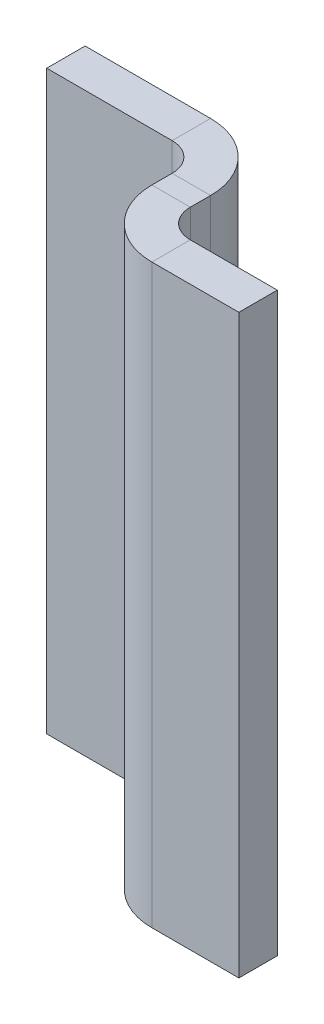
from build123d import *

# Parameters (mm, degrees)
SKETCH1_W                    = 4
SKETCH1_H                    = 15
BASE_FLANGE1_DEPTH           = 1
EDGE_FLANGE1_STRIP_W         = 5.4732
EDGE_FLANGE1_STRIP_H         = 1
EDGE_FLANGE1_STRIP_CUT_DEPTH = 15
EDGE_FLANGE1_DEPTH           = 15
EDGE_FLANGE2_STRIP_W         = 5.4732
EDGE_FLANGE2_STRIP_H         = 1
EDGE_FLANGE2_STRIP_CUT_DEPTH = 15
EDGE_FLANGE2_DEPTH           = 15


# Sheet-metal steps are written as plain solids
with BuildPart() as part:
    # Sketch1 → Base-Flange1 (new body)
    with BuildSketch(Plane.XY):
        with Locations((2, 7.5)):
            Rectangle(SKETCH1_W, SKETCH1_H)
    extrude(amount=-BASE_FLANGE1_DEPTH)

    # Edge-Flange1 strip (across the edge) → Edge-Flange1 strip cut (cut)
    with BuildSketch(Plane(origin=(4, 0, 0), x_dir=(-1, 0, 0), z_dir=(0, 1, 0))):
        with Locations((-2, -0.5)):
            Rectangle(EDGE_FLANGE1_STRIP_W, EDGE_FLANGE1_STRIP_H)
    extrude(amount=EDGE_FLANGE1_STRIP_CUT_DEPTH, mode=Mode.SUBTRACT)

    # Edge-Flange1 section (across the edge) → Edge-Flange1 (add)
    with BuildSketch(Plane(origin=(4, 0, 0), x_dir=(-1, 0, 0), z_dir=(0, 1, 0))):
        with BuildLine():
            Line((-1, 0.7366), (-1, 2))
            Line((-1, 2), (0, 2))
            Line((0, 2), (0, 0.7366))
            ThreePointArc((0, 0.7366), (0.215745145, 0.215745145), (0.7366, 0))
            Line((0.7366, 0), (0.7366, -1))
            ThreePointArc((0.7366, -1), (-0.491361636, -0.491361636), (-1, 0.7366))
        make_face()
    extrude(amount=EDGE_FLANGE1_DEPTH)

    # Edge-Flange2 strip (across the edge) → Edge-Flange2 strip cut (cut)
    with BuildSketch(Plane(origin=(5, 15, 2), x_dir=(0, 0, -1), z_dir=(0, -1, 0))):
        with Locations((-2, -0.5)):
            Rectangle(EDGE_FLANGE2_STRIP_W, EDGE_FLANGE2_STRIP_H)
    extrude(amount=EDGE_FLANGE2_STRIP_CUT_DEPTH, mode=Mode.SUBTRACT)

    # Edge-Flange2 section (across the edge) → Edge-Flange2 (add)
    with BuildSketch(Plane(origin=(5, 15, 2), x_dir=(0, 0, -1), z_dir=(0, -1, 0))):
        with BuildLine():
            Line((-1, 0.7366), (-1, 3))
            Line((-1, 3), (0, 3))
            Line((0, 3), (0, 0.7366))
            ThreePointArc((0, 0.7366), (0.215745145, 0.215745145), (0.7366, 0))
            Line((0.7366, 0), (0.7366, -1))
            ThreePointArc((0.7366, -1), (-0.491361636, -0.491361636), (-1, 0.7366))
        make_face()
    extrude(amount=EDGE_FLANGE2_DEPTH)


solid = part.part
